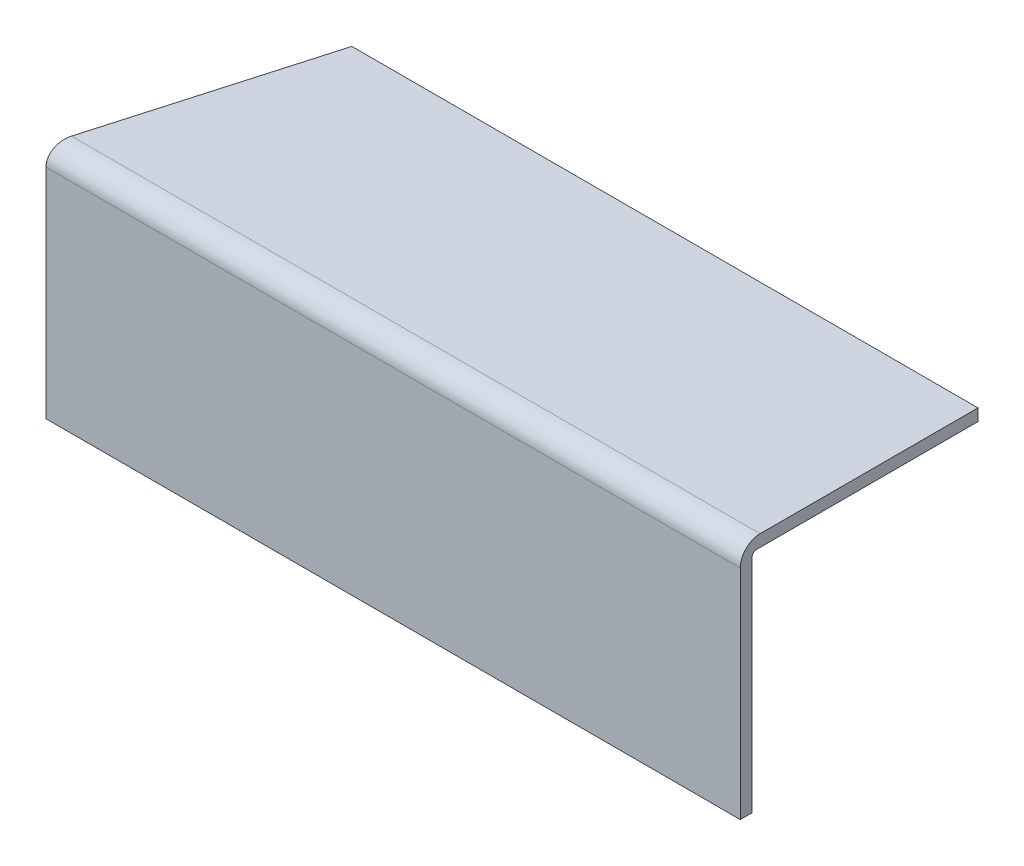
from build123d import *

# Parameters (mm, degrees)
BOSS_EXTRUDE1_DEPTH = 87.625
FILLET1_R           = 5
FILLET2_R           = 1
CUT_EXTRUDE1_DEPTH  = 122.975983804


with BuildPart() as part:
    # Sketch1 → Boss-Extrude1 (new, symmetric)
    with BuildSketch(Plane(origin=(0, 0, 0), x_dir=(0, 0, -1), z_dir=(1, 0, 0))):
        Polygon((0, 0), (0, 60), (3, 60), (3, 3), (60, 3), (60, 0), align=None)
    extrude(amount=BOSS_EXTRUDE1_DEPTH, both=True)

    # Fillet1
    fillet1_edges = [part.edges().sort_by_distance(p)[0] for p in [
        (0, 0, 0),
    ]]
    fillet(fillet1_edges, radius=FILLET1_R)

    # Fillet2
    fillet2_edges = [part.edges().sort_by_distance(p)[0] for p in [
        (0, 3, -3),
    ]]
    fillet(fillet2_edges, radius=FILLET2_R)

    # Sketch2 → Cut-Extrude1 (cut, through all)
    with BuildSketch(Plane.XZ):
        Polygon((-100.15269486, 43.689264004), (-57.118497589, -106.38881714), (-93.92306906, -116.942358184), (-136.957266332, 33.13572296), align=None)
    extrude(amount=-CUT_EXTRUDE1_DEPTH, mode=Mode.SUBTRACT)


with BuildPart() as body_2:
    # Mirror1: mirrored copy
    add(part.part.mirror(Plane(origin=(87.625, 60, -3), x_dir=(0, 0, 1), z_dir=(0, -1, 0))))


solid = body_2.part
